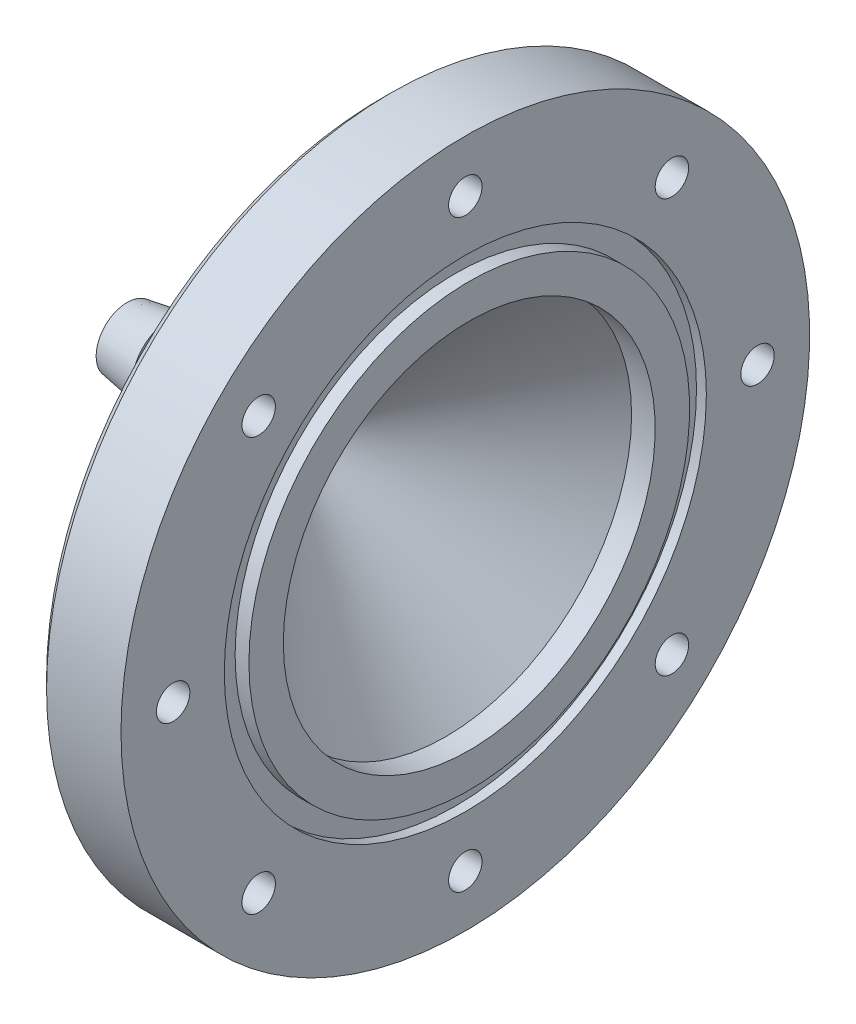
from build123d import *

# Parameters (mm, degrees)
CBORE_FOR_M3_HEX_SOCKET_HEAD_CAP_SCREW2_D           = 3.4
CBORE_FOR_M3_HEX_SOCKET_HEAD_CAP_SCREW2_DEPTH       = 8.566
CBORE_FOR_M3_HEX_SOCKET_HEAD_CAP_SCREW2_CBORE_D     = 6.5
CBORE_FOR_M3_HEX_SOCKET_HEAD_CAP_SCREW2_CBORE_DEPTH = 3.4
CBORE_FOR_M3_HEX_SOCKET_HEAD_CAP_SCREW2_TIP         = 1.021463052
CHAMFER1_SIZE                                       = 1


with BuildPart() as part:
    # Sketch1 → Revolve17 (revolve)
    with BuildSketch(Plane.XY):
        Polygon((-13.572880732, 3.15), (-13.572880732, 3.85), (-17.906214066, 3.15), (-17.906214066, 1.9), (0, 1.9), (14.469928658, 18.9), (16.869928658, 18.9), (16.869928658, 22.4), (15.469928658, 22.4), (15.469928658, 24.5), (16.469928658, 24.5), (16.469928658, 35), (7.903928658, 35), (7.903928658, 18.9), (-4.906214066, 3.85), (-9.239547399, 3.15), (-9.239547399, 3.85), align=None)
    revolve(axis=Axis((-801.920554309, 0, 0), (1, 0, 0)))

    # CBORE for M3 Hex Socket Head Cap Screw2
    with Locations(Plane.ZY.offset(-7.903928658)):
        with Locations((-21.001071401, -21.154915542), (0, 29.7), (29.7, 0), (-29.7, 0), (0, -29.7), (-21.001071401, 20.847227261), (21.001071401, 20.847227261), (21.001071401, -21.154915542)):
            CounterBoreHole(CBORE_FOR_M3_HEX_SOCKET_HEAD_CAP_SCREW2_D / 2, CBORE_FOR_M3_HEX_SOCKET_HEAD_CAP_SCREW2_CBORE_D / 2, CBORE_FOR_M3_HEX_SOCKET_HEAD_CAP_SCREW2_CBORE_DEPTH, depth=CBORE_FOR_M3_HEX_SOCKET_HEAD_CAP_SCREW2_DEPTH)
            with Locations((0, 0, -(CBORE_FOR_M3_HEX_SOCKET_HEAD_CAP_SCREW2_DEPTH + CBORE_FOR_M3_HEX_SOCKET_HEAD_CAP_SCREW2_TIP / 2))):  # 118° drill point
                Cone(0, CBORE_FOR_M3_HEX_SOCKET_HEAD_CAP_SCREW2_D / 2, CBORE_FOR_M3_HEX_SOCKET_HEAD_CAP_SCREW2_TIP, mode=Mode.SUBTRACT)

    # Chamfer1
    chamfer1_edges = [part.edges().sort_by_distance(p)[0] for p in [
        (7.903928658, -35, 0),
    ]]
    chamfer(chamfer1_edges, length=CHAMFER1_SIZE)


solid = part.part
